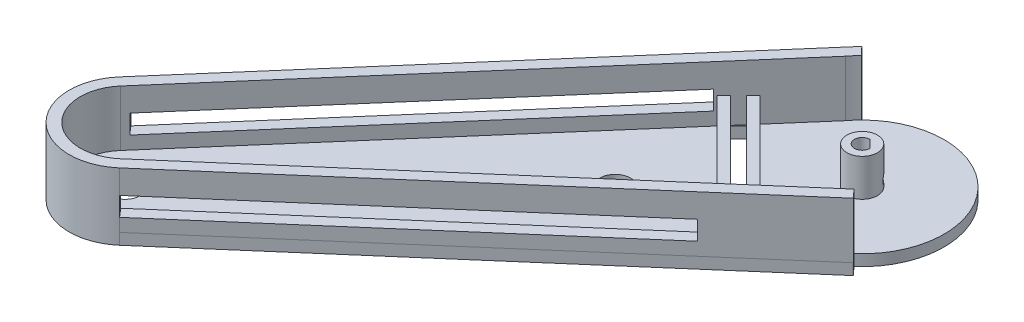
from build123d import *

# Parameters (mm, degrees)
SKETCH_2_R               = 2.1
SKETCH_2_R_2             = 4.1
EXTRUDE_2_DEPTH          = 3
EXTRUDE_3_DEPTH          = 15
SKETCH_4_R               = 4.1
SKETCH_4_R_2             = 2.1
EXTRUDE_4_DEPTH          = 10
EXTRUDE_START            = -13
EXTRUDE_5_DEPTH          = 13
SKETCH_7_R               = 1.3
CUT_EXTRUDE_1_DEPTH      = 13
CUT_EXTRUDE_2_DEPTH      = 174.68818701
CUT_EXTRUDE_2_DEPTH_BACK = 174.68818701
SKETCH_8_W               = 110
SKETCH_8_H               = 2.6
SKETCH_8_H_2             = 2.5
CUT_EXTRUDE_3_DEPTH      = 172.969913078
CUT_EXTRUDE_3_DEPTH_BACK = 172.969913078
EXTRUDE_6_DEPTH          = 10
SKETCH_11_R              = 2
CUT_EXTRUDE_4_DEPTH      = 10
SKETCH_13_R              = 2.05
CUT_EXTRUDE_5_DEPTH      = 10
SKETCH_14_R              = 4.1
EXTRUDE_7_DEPTH          = 3
CUT_EXTRUDE_6_DEPTH      = 3


# Read off the part's stored shape, not the designer's step: 凸台-拉伸3, 凸台-拉伸5
with BuildPart() as part:
    # 草图2 → 凸台-拉伸2 (new body)
    with BuildSketch(Plane(origin=(0, 0, 0), x_dir=(1, 0, 0), z_dir=(0, 1, 0))):
        with BuildLine():
            Line((80.099742919, 115.241133642), (-11.337123868, 9.698254241))
            ThreePointArc((-11.337123868, 9.698254241), (-10.606601718, -10.730242528), (9.821895051, -11.460764678))
            Line((9.821895051, -11.460764678), (115.364774452, 79.976102109))
            ThreePointArc((115.364774452, 79.976102109), (115.409508589, 80.014950331), (115.454150533, 80.053904459))
            Line((115.454150533, 80.053904459), (113.400395441, 82.243526883))
            ThreePointArc((113.400395441, 82.243526883), (115.041169115, 113.92185113), (83.322768112, 114.310956698))
            Line((83.322768112, 114.310956698), (81.26901302, 116.500579122))
            ThreePointArc((81.26901302, 116.500579122), (80.673552706, 115.880906565), (80.099742919, 115.241133642))
        make_face()
        with Locations(Location((98.994949366, 98.871308556, 0), (0, 0, 270))):
            Circle(SKETCH_2_R, mode=Mode.SUBTRACT)
        with Locations(Location((0, -0.12364081, 0), (0, 0, 270))):
            Circle(SKETCH_2_R_2, mode=Mode.SUBTRACT)
        with Locations(Location((70.710678119, 70.587037309, 0), (0, 0, 270))):
            Circle(SKETCH_2_R_2, mode=Mode.SUBTRACT)
    extrude(amount=EXTRUDE_2_DEPTH)

    # 凸台-拉伸3 outline → 凸台-拉伸3 (add)
    with BuildSketch(Plane(origin=(0, 3, 0), x_dir=(1, 0, 0), z_dir=(0, 1, 0))):
        with BuildLine():
            ThreePointArc((-11.337123868, 9.698254241), (-10.606601718, -10.730242528), (9.821895051, -11.460764678))
            Line((9.821895051, -11.460764678), (115.454150533, 80.053904459))
            Line((115.454150533, 80.053904459), (113.400395441, 82.243526883))
            ThreePointArc((113.400395441, 82.243526883), (113.358376595, 82.207216674), (113.316266225, 82.171012648))
            Line((113.316266225, 82.171012648), (7.857534265, -9.193324116))
            ThreePointArc((7.857534265, -9.193324116), (-8.484829636, -8.609373899), (-9.07051987, 7.732927734))
            Line((-9.07051987, 7.732927734), (81.368262538, 112.03565098))
            ThreePointArc((81.368262538, 112.03565098), (82.306692779, 113.206652712), (83.322768112, 114.310956698))
            Line((83.322768112, 114.310956698), (81.26901302, 116.500579122))
            Line((81.26901302, 116.500579122), (-11.337123868, 9.698254241))
        make_face()
    extrude(amount=EXTRUDE_3_DEPTH)

    # 草图4 → 凸台-拉伸4 (add)
    with BuildSketch(Plane(origin=(0, 3, 0), x_dir=(1, 0, 0), z_dir=(0, 1, 0))):
        with Locations(Location((98.994949366, 98.871308556, 0), (0, 0, 270))):
            Circle(SKETCH_4_R)
        with Locations(Location((98.994949366, 98.871308556, 0), (0, 0, 270))):
            Circle(SKETCH_4_R_2, mode=Mode.SUBTRACT)
    extrude(amount=EXTRUDE_4_DEPTH)

    # 凸台-拉伸5 outline → 凸台-拉伸5 (add)
    with BuildSketch(Plane(origin=(0, 13, 0), x_dir=(1, 0, 0), z_dir=(0, 1, 0)).offset(EXTRUDE_START)):
        with BuildLine():
            ThreePointArc((101.094850935, 98.891640782), (100.479873606, 100.356232796), (99.015281592, 100.971210125))
            Line((99.015281592, 100.971210125), (101.094850935, 98.891640782))
        make_face()
    extrude(amount=EXTRUDE_5_DEPTH)

    # 草图7 → 切除-拉伸1 (cut)
    with BuildSketch(Plane(origin=(99.993245858, 0, -99.993245858), x_dir=(0.7071067811865475, 0, 0.7071067811865477), z_dir=(-0.7071067811865477, 0, 0.7071067811865475))):
        with Locations((0, 5)):
            Circle(SKETCH_7_R)
    extrude(amount=-CUT_EXTRUDE_1_DEPTH, mode=Mode.SUBTRACT)

    # 草图8 → 切除-拉伸2 (cut, two sides: drawn at the far end of the back side and taken through both)
    with BuildSketch(Plane(origin=(9.883107451, 0, 11.40773322), x_dir=(0.75580694217799, 0, -0.6547945220873159), z_dir=(0.6547945220873159, 0, 0.75580694217799)).offset(-CUT_EXTRUDE_2_DEPTH_BACK)):
        with Locations((54.959520341, 10.3)):
            Rectangle(SKETCH_8_W, SKETCH_8_H)
        with Locations((54.959520341, 7.75)):
            Rectangle(SKETCH_8_W, SKETCH_8_H_2)
    extrude(amount=CUT_EXTRUDE_2_DEPTH + CUT_EXTRUDE_2_DEPTH_BACK, mode=Mode.SUBTRACT)

    # 草图9 → 切除-拉伸3 (cut, two sides: drawn at the far end of the back side and taken through both)
    with BuildSketch(Plane.XZ.offset(-CUT_EXTRUDE_3_DEPTH_BACK)):
        Polygon((83.449732713, -83.303817091), (81.326556947, -81.184353794), (67.196801633, -95.338858899), (69.319977399, -97.458322196), align=None)
        Polygon((95.456312261, -67.02984869), (81.326556947, -81.184353794), (83.449732713, -83.303817091), (97.579488027, -69.149311987), align=None)
    extrude(amount=CUT_EXTRUDE_3_DEPTH + CUT_EXTRUDE_3_DEPTH_BACK, mode=Mode.SUBTRACT)

    # 草图10 → 凸台-拉伸6 (add)
    with BuildSketch(Plane(origin=(0, 3, 0), x_dir=(1, 0, 0), z_dir=(0, 1, 0))):
        Polygon((81.326556947, 81.184353794), (70.022752696, 92.507957878), (68.182667032, 90.671089687), (79.486471284, 79.347485603), align=None)
        Polygon((92.630361199, 69.86074971), (81.326556947, 81.184353794), (79.486471284, 79.347485603), (90.790275535, 68.02388152), align=None)
        Polygon((73.986014125, 96.464289366), (72.145928462, 94.627421175), (83.449732713, 83.303817091), (94.753536964, 71.980213008), (96.593622628, 73.817081198), align=None)
    extrude(amount=EXTRUDE_6_DEPTH)

    # 草图11 → 切除-拉伸4 (cut)
    with BuildSketch(Plane(origin=(85.289818377, 0, -85.140685282), x_dir=(-0.7064877657092933, 0, -0.707725255238988), z_dir=(0.707725255238988, 0, -0.7064877657092933))):
        with Locations((-9.96499851, 8)):
            Circle(SKETCH_11_R)
        with Locations((9.96499851, 8)):
            Circle(SKETCH_11_R)
    extrude(amount=-CUT_EXTRUDE_4_DEPTH, mode=Mode.SUBTRACT)

    # 草图13 → 切除-拉伸5 (cut)
    with BuildSketch(Plane(origin=(85.289818377, 0, -85.140685282), x_dir=(-0.7064877657092933, 0, -0.707725255238988), z_dir=(0.707725255238988, 0, -0.7064877657092933))):
        with Locations((-9.96499851, 8)):
            Circle(SKETCH_13_R)
        with Locations((9.964998511, 8)):
            Circle(SKETCH_13_R)
    extrude(amount=-CUT_EXTRUDE_5_DEPTH, mode=Mode.SUBTRACT)

    # 草图14 → 凸台-拉伸7 (add)
    with BuildSketch(Plane.XZ):
        with Locations((70.710678119, -70.587037309)):
            Circle(SKETCH_14_R)
    extrude(amount=-EXTRUDE_7_DEPTH)

    # 草图15 → 切除-拉伸6 (cut)
    with BuildSketch(Plane.XZ):
        with BuildLine():
            ThreePointArc((69.902009877, -65.719825747), (67.369828397, -61.931429637), (62.901061054, -62.822500095))
            Line((62.901061054, -62.822500095), (65.802009877, -65.719825747))
            Line((65.802009877, -65.719825747), (68.702958699, -68.617151398))
            ThreePointArc((68.702958699, -68.617151398), (69.590405987, -67.287644267), (69.902009877, -65.719825747))
        make_face()
        with BuildLine():
            Line((65.802009877, -65.719825747), (62.901061054, -62.822500095))
            ThreePointArc((62.901061054, -62.822500095), (62.904684226, -68.620774569), (68.702958699, -68.617151398))
            Line((68.702958699, -68.617151398), (65.802009877, -65.719825747))
        make_face()
    extrude(amount=-CUT_EXTRUDE_6_DEPTH, mode=Mode.SUBTRACT)


solid = part.part
